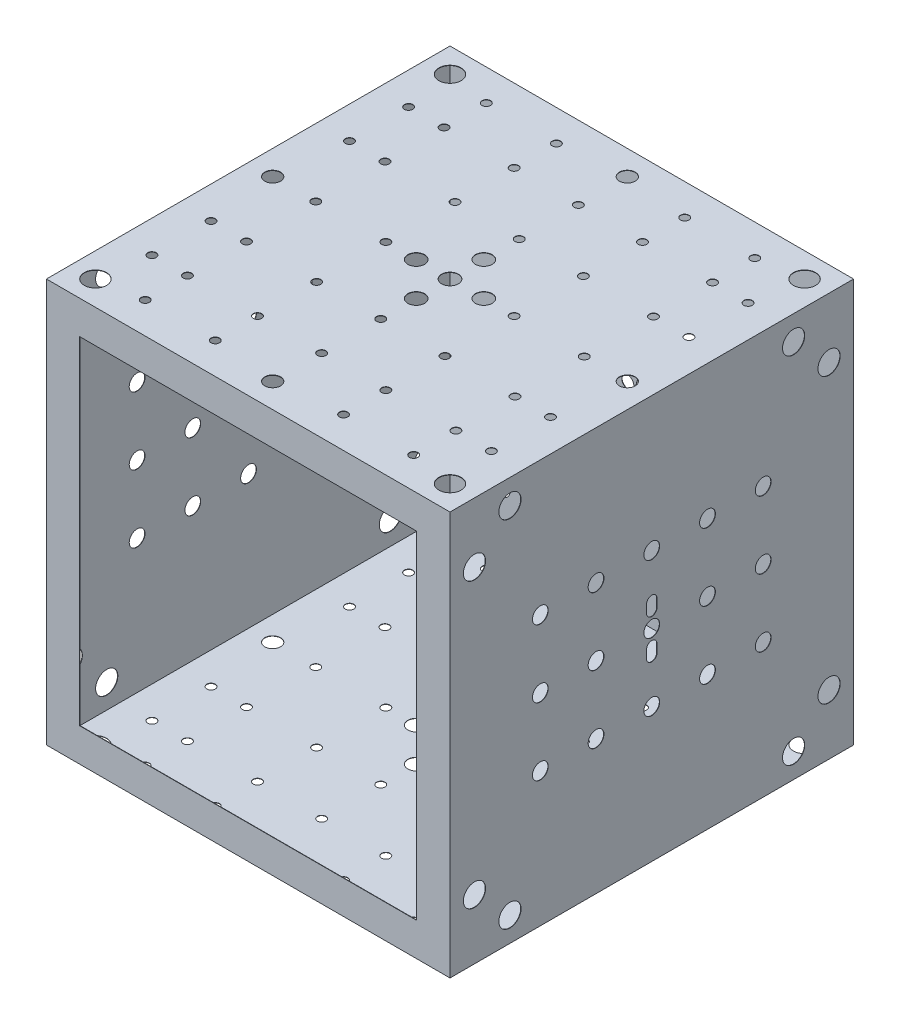
from build123d import *

# Parameters (mm, degrees)
SKETCH1_W           = 2390
SKETCH1_H           = 2390
BOSS_EXTRUDE1_DEPTH = 2390
SKETCH7_W           = 2386
SKETCH7_H           = 2386
CUT_EXTRUDE2_DEPTH  = 2388
SKETCH10_W          = 2390
SKETCH10_H          = 2388
SKETCH10_W_2        = 1995.67001675
SKETCH10_H_2        = 1996
BOSS_EXTRUDE4_DEPTH = 2
SKETCH11_R          = 49.85
SKETCH11_R_2        = 25
SKETCH11_R_3        = 46.75
SKETCH11_R_4        = 65.8
CUT_EXTRUDE3_DEPTH  = 2928.140242626
SKETCH12_R          = 91.2
SKETCH12_R_2        = 35.635
SKETCH12_R_3        = 65.8
CUT_EXTRUDE4_DEPTH  = 3586
SKETCH13_R          = 46.75
SKETCH13_R_2        = 65.8
CUT_EXTRUDE5_DEPTH  = 3586


with BuildPart() as part:
    # Sketch1 → Boss-Extrude1 (new body)
    with BuildSketch(Plane(origin=(0, 0, 0), x_dir=(1, 0, 0), z_dir=(0, 1, 0))):
        Rectangle(SKETCH1_W, SKETCH1_H)
    extrude(amount=BOSS_EXTRUDE1_DEPTH)

    # Sketch7 → Cut-Extrude2 (cut)
    with BuildSketch(Plane.XY.offset(1195)):
        with Locations((0, 1195)):
            Rectangle(SKETCH7_W, SKETCH7_H)
    extrude(amount=-CUT_EXTRUDE2_DEPTH, mode=Mode.SUBTRACT)

    # Sketch10 → Boss-Extrude4 (add)
    with BuildSketch(Plane.XY.offset(1195)):
        with Locations((0, 1194)):
            Rectangle(SKETCH10_W, SKETCH10_H)
        with Locations((0, 1195)):
            Rectangle(SKETCH10_W_2, SKETCH10_H_2, mode=Mode.SUBTRACT)
    extrude(amount=-BOSS_EXTRUDE4_DEPTH)

    # Sketch11 → Cut-Extrude3 (cut, through all)
    with BuildSketch(Plane(origin=(0, 2390, 0), x_dir=(1, 0, 0), z_dir=(0, 1, 0))):
        Circle(SKETCH11_R)
        with Locations((200, 0)):
            Circle(SKETCH11_R)
        with Locations((-200, 0)):
            Circle(SKETCH11_R)
        with Locations((0, 200)):
            Circle(SKETCH11_R)
        with Locations((0, -200)):
            Circle(SKETCH11_R)
        with Locations((-380, 0)):
            Circle(SKETCH11_R_2)
        with Locations((-795, 0)):
            Circle(SKETCH11_R_2)
        with Locations((-1050, 0)):
            Circle(SKETCH11_R_3)
        with Locations((-1050, 1050)):
            Circle(SKETCH11_R_4)
        with Locations((380, 0)):
            Circle(SKETCH11_R_2)
        with Locations((795, 0)):
            Circle(SKETCH11_R_2)
        with Locations((1050, 0)):
            Circle(SKETCH11_R_3)
        with Locations((1050, 1050)):
            Circle(SKETCH11_R_4)
        with Locations((-380, 410)):
            Circle(SKETCH11_R_2)
        with Locations((-795, 410)):
            Circle(SKETCH11_R_2)
        with Locations((380, 410)):
            Circle(SKETCH11_R_2)
        with Locations((795, 410)):
            Circle(SKETCH11_R_2)
        with Locations((0, 410)):
            Circle(SKETCH11_R_2)
        with Locations((-795, 760)):
            Circle(SKETCH11_R_2)
        with Locations((-380, 760)):
            Circle(SKETCH11_R_2)
        with Locations((0, 760)):
            Circle(SKETCH11_R_2)
        with Locations((380, 760)):
            Circle(SKETCH11_R_2)
        with Locations((795, 760)):
            Circle(SKETCH11_R_2)
        with Locations((-795, 1010)):
            Circle(SKETCH11_R_2)
        with Locations((-380, 1010)):
            Circle(SKETCH11_R_2)
        with Locations((380, 1010)):
            Circle(SKETCH11_R_2)
        with Locations((795, 1010)):
            Circle(SKETCH11_R_2)
        with Locations((0, 1050)):
            Circle(SKETCH11_R_3)
        with Locations((-1005, 760)):
            Circle(SKETCH11_R_2)
        with Locations((-1005, 410)):
            Circle(SKETCH11_R_2)
        with Locations((1005, 410)):
            Circle(SKETCH11_R_2)
        with Locations((1005, 760)):
            Circle(SKETCH11_R_2)
        with Locations((1005, -410)):
            Circle(SKETCH11_R_2)
        with Locations((795, -410)):
            Circle(SKETCH11_R_2)
        with Locations((380, -410)):
            Circle(SKETCH11_R_2)
        with Locations((0, -410)):
            Circle(SKETCH11_R_2)
        with Locations((-380, -410)):
            Circle(SKETCH11_R_2)
        with Locations((-795, -410)):
            Circle(SKETCH11_R_2)
        with Locations((-1005, -410)):
            Circle(SKETCH11_R_2)
        with Locations((-1005, -760)):
            Circle(SKETCH11_R_2)
        with Locations((-795, -760)):
            Circle(SKETCH11_R_2)
        with Locations((-380, -760)):
            Circle(SKETCH11_R_2)
        with Locations((0, -760)):
            Circle(SKETCH11_R_2)
        with Locations((380, -760)):
            Circle(SKETCH11_R_2)
        with Locations((795, -760)):
            Circle(SKETCH11_R_2)
        with Locations((1005, -760)):
            Circle(SKETCH11_R_2)
        with Locations((1050, -1050)):
            Circle(SKETCH11_R_4)
        with Locations((795, -1010)):
            Circle(SKETCH11_R_2)
        with Locations((380, -1010)):
            Circle(SKETCH11_R_2)
        with Locations((0, -1050)):
            Circle(SKETCH11_R_3)
        with Locations((-380, -1010)):
            Circle(SKETCH11_R_2)
        with Locations((-795, -1010)):
            Circle(SKETCH11_R_2)
        with Locations((-1050, -1050)):
            Circle(SKETCH11_R_4)
    extrude(amount=-CUT_EXTRUDE3_DEPTH, mode=Mode.SUBTRACT)

    # Sketch12 → Cut-Extrude4 (cut, through all)
    with BuildSketch(Plane(origin=(0, 0, -1195), x_dir=(-1, 0, 0), z_dir=(0, 0, -1))):
        with Locations((0, 1195)):
            Circle(SKETCH12_R)
        with Locations((0, 1335)):
            Circle(SKETCH12_R_2)
        with Locations((-900, 2095)):
            Circle(SKETCH12_R_3)
        with Locations((-222, 1577)):
            Circle(SKETCH12_R)
        with Locations((222, 813)):
            Circle(SKETCH12_R)
        with Locations((900, 2095)):
            Circle(SKETCH12_R_3)
        with Locations((900, 295)):
            Circle(SKETCH12_R_3)
        with Locations((-900, 295)):
            Circle(SKETCH12_R_3)
        with Locations((-140, 1195)):
            Circle(SKETCH12_R_2)
        with Locations((0, 1055)):
            Circle(SKETCH12_R_2)
        with Locations((140, 1195)):
            Circle(SKETCH12_R_2)
    extrude(amount=-CUT_EXTRUDE4_DEPTH, mode=Mode.SUBTRACT)

    # Sketch13 → Cut-Extrude5 (cut, through all)
    with BuildSketch(Plane.ZY.offset(1195)):
        with Locations((0, 1195)):
            Circle(SKETCH13_R)
        with Locations((0, 1595)):
            Circle(SKETCH13_R)
        with Locations((-330, 1595)):
            Circle(SKETCH13_R)
        with Locations((-330, 1195)):
            Circle(SKETCH13_R)
        with Locations((-660, 1595)):
            Circle(SKETCH13_R)
        with Locations((-660, 1195)):
            Circle(SKETCH13_R)
        with Locations((-840, 2245)):
            Circle(SKETCH13_R_2)
        with Locations((-1050, 2035)):
            Circle(SKETCH13_R_2)
        with Locations((330, 1595)):
            Circle(SKETCH13_R)
        with Locations((330, 1195)):
            Circle(SKETCH13_R)
        with Locations((660, 1195)):
            Circle(SKETCH13_R)
        with Locations((660, 1595)):
            Circle(SKETCH13_R)
        with Locations((840, 2245)):
            Circle(SKETCH13_R_2)
        with Locations((1050, 2035)):
            Circle(SKETCH13_R_2)
        with Locations((-660, 795)):
            Circle(SKETCH13_R)
        with Locations((-330, 795)):
            Circle(SKETCH13_R)
        with Locations((0, 795)):
            Circle(SKETCH13_R)
        with Locations((330, 795)):
            Circle(SKETCH13_R)
        with Locations((660, 795)):
            Circle(SKETCH13_R)
        with Locations((1050, 355)):
            Circle(SKETCH13_R_2)
        with Locations((840, 145)):
            Circle(SKETCH13_R_2)
        with Locations((-840, 145)):
            Circle(SKETCH13_R_2)
        with Locations((-1050, 355)):
            Circle(SKETCH13_R_2)
        with BuildLine():
            Line((30.937502197, 1055.000002862), (30.937497803, 1102.500002862))
            ThreePointArc((30.937497803, 1102.500002862), (-5.06e-06, 1133.4375), (-30.937502197, 1102.499997138))
            Line((-30.937502197, 1102.499997138), (-30.937497803, 1054.999997138))
            ThreePointArc((-30.937497803, 1054.999997138), (5.06e-06, 1024.0625), (30.937502197, 1055.000002862))
        make_face()
        with BuildLine():
            Line((30.937502197, 1334.999997138), (30.937497803, 1287.499997138))
            ThreePointArc((30.937497803, 1287.499997138), (-5.06e-06, 1256.5625), (-30.937502197, 1287.500002862))
            Line((-30.937502197, 1287.500002862), (-30.937497803, 1335.000002862))
            ThreePointArc((-30.937497803, 1335.000002862), (5.06e-06, 1365.9375), (30.937502197, 1334.999997138))
        make_face()
    extrude(amount=-CUT_EXTRUDE5_DEPTH, mode=Mode.SUBTRACT)


solid = part.part
